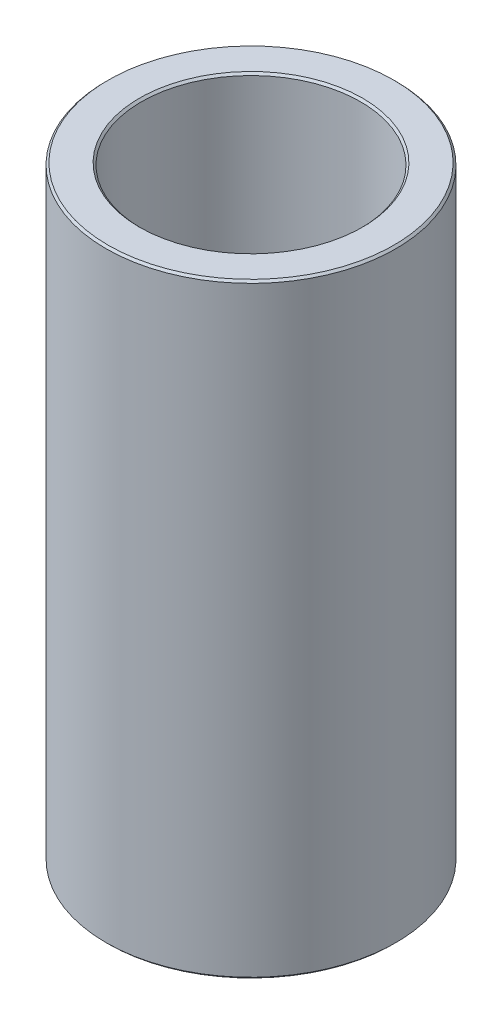
from build123d import *

# Parameters (mm, degrees)
SKETCH1_R           = 52.5
BOSS_EXTRUDE1_DEPTH = 219.131312831
SKETCH2_R           = 39.703612077
CUT_EXTRUDE1_DEPTH  = 232.367742486
CHAMFER1_SIZE       = 0.743105319


with BuildPart() as part:
    # Sketch1 → Boss-Extrude1 (new body)
    with BuildSketch(Plane(origin=(0, 0, 0), x_dir=(1, 0, 0), z_dir=(0, 1, 0))):
        Circle(SKETCH1_R)
    extrude(amount=BOSS_EXTRUDE1_DEPTH)

    # Sketch2 → Cut-Extrude1 (cut, through all)
    with BuildSketch(Plane(origin=(0, 0, 0), x_dir=(1, 0, 0), z_dir=(0, 1, 0))):
        Circle(SKETCH2_R)
    extrude(amount=CUT_EXTRUDE1_DEPTH, mode=Mode.SUBTRACT)

    # Chamfer1
    chamfer1_edges = [part.edges().sort_by_distance(p)[0] for p in [
        (-39.703612077, 219.131312831, 0),
        (-39.703612077, 0, 0),
        (-52.5, 0, 0),
        (-52.5, 219.131312831, 0),
    ]]
    chamfer(chamfer1_edges, length=CHAMFER1_SIZE)


solid = part.part
